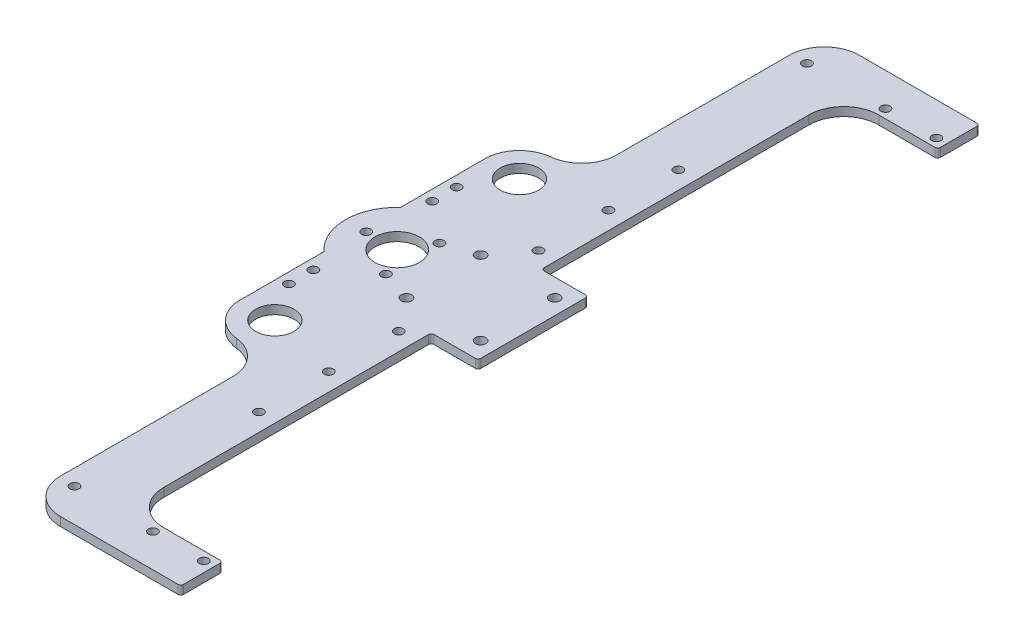
from build123d import *

# Parameters (mm, degrees)
SKETCH1_R           = 6.985
SKETCH1_R_2         = 1.6499967
SKETCH1_R_3         = 8.0645
BOSS_EXTRUDE1_DEPTH = 3.175
SKETCH4_R           = 1.65
CUT_EXTRUDE1_DEPTH  = 199.349545248
SKETCH5_R           = 1.89865
CUT_EXTRUDE2_DEPTH  = 199.349545248
FILLET1_R           = 1


with BuildPart() as part:
    # Sketch1 → Boss-Extrude1 (new body)
    with BuildSketch(Plane(origin=(0, 0, 0), x_dir=(1, 0, 0), z_dir=(0, 1, 0))):
        with BuildLine():
            ThreePointArc((-67.971311517, -24.866245744), (-74.128017531, -38.797272158), (-67.971311517, -52.728298572))
            Line((-67.971311517, -52.728298572), (-67.971311517, -82.586411585))
            ThreePointArc((-67.971311517, -82.586411585), (-64.941959488, -91.499608698), (-56.608448003, -95.878494725))
            ThreePointArc((-56.608448003, -95.878494725), (-48.492989851, -100.008926653), (-45.228378476, -108.509717293))
            Line((-45.228378476, -108.509717293), (-45.228378476, -171.249717293))
            ThreePointArc((-45.228378476, -171.249717293), (-41.508634597, -180.229973414), (-32.528378476, -183.949717293))
            Line((-32.528378476, -183.949717293), (7.398418219, -183.949717293))
            Line((7.398418219, -183.949717293), (11.211482469, -183.949717293))
            Line((11.211482469, -183.949717293), (11.211482469, -168.709717293))
            Line((11.211482469, -168.709717293), (-10.203517531, -168.709717293))
            ThreePointArc((-10.203517531, -168.709717293), (-19.183773652, -164.989973414), (-22.903517531, -156.009717293))
            Line((-22.903517531, -156.009717293), (-22.903517531, -58.797272158))
            Line((-22.903517531, -58.797272158), (-5.903517531, -58.797272158))
            Line((-5.903517531, -58.797272158), (-5.903517531, -38.797272158))
            Line((-5.903517531, -38.797272158), (-5.903517531, -18.797272158))
            Line((-5.903517531, -18.797272158), (-22.903517531, -18.797272158))
            Line((-22.903517531, -18.797272158), (-22.903517531, 78.415172977))
            ThreePointArc((-22.903517531, 78.415172977), (-19.183773652, 87.395429098), (-10.203517531, 91.115172977))
            Line((-10.203517531, 91.115172977), (11.211482469, 91.115172977))
            Line((11.211482469, 91.115172977), (11.211482469, 106.355172977))
            Line((11.211482469, 106.355172977), (-32.528378476, 106.355172977))
            ThreePointArc((-32.528378476, 106.355172977), (-41.508634597, 102.635429098), (-45.228378476, 93.655172977))
            Line((-45.228378476, 93.655172977), (-45.228378476, 30.915172977))
            ThreePointArc((-45.228378476, 30.915172977), (-48.492989851, 22.414382337), (-56.608448003, 18.28395041))
            ThreePointArc((-56.608448003, 18.28395041), (-64.941959488, 13.905064383), (-67.971311517, 4.991867269))
            Line((-67.971311517, 4.991867269), (-67.971311517, -24.866245744))
        make_face()
        with Locations((-55.288517531, -83.247272158)):
            Circle(SKETCH1_R, mode=Mode.SUBTRACT)
        with Locations((-64.161311517, -69.277272158)):
            Circle(SKETCH1_R_2, mode=Mode.SUBTRACT)
        with Locations((-64.161311517, -60.387272158)):
            Circle(SKETCH1_R_2, mode=Mode.SUBTRACT)
        with Locations((-49.668767531, -48.530964684)):
            Circle(SKETCH1_R_2, mode=Mode.SUBTRACT)
        with Locations((-29.342032123, -114.997272158)):
            Circle(SKETCH1_R_2, mode=Mode.SUBTRACT)
        with Locations((-29.342032123, -89.597272158)):
            Circle(SKETCH1_R_2, mode=Mode.SUBTRACT)
        with Locations((-29.342032123, -64.197272158)):
            Circle(SKETCH1_R_2, mode=Mode.SUBTRACT)
        with Locations((-66.528017531, -38.797272158)):
            Circle(SKETCH1_R_2, mode=Mode.SUBTRACT)
        with Locations((-64.161311517, -17.207272158)):
            Circle(SKETCH1_R_2, mode=Mode.SUBTRACT)
        with Locations((-64.161311517, -8.317272158)):
            Circle(SKETCH1_R_2, mode=Mode.SUBTRACT)
        with Locations((-55.288517531, -38.797272158)):
            Circle(SKETCH1_R_3, mode=Mode.SUBTRACT)
        with Locations((-55.288517531, 5.652727842)):
            Circle(SKETCH1_R, mode=Mode.SUBTRACT)
        with Locations((-49.668767531, -29.063579632)):
            Circle(SKETCH1_R_2, mode=Mode.SUBTRACT)
        with Locations((-29.342032123, -13.397272158)):
            Circle(SKETCH1_R_2, mode=Mode.SUBTRACT)
        with Locations((-29.342032123, 12.002727842)):
            Circle(SKETCH1_R_2, mode=Mode.SUBTRACT)
        with Locations((-29.342032123, 37.402727842)):
            Circle(SKETCH1_R_2, mode=Mode.SUBTRACT)
    extrude(amount=BOSS_EXTRUDE1_DEPTH)

    # Sketch4 → Cut-Extrude1 (cut, through all)
    with BuildSketch(Plane(origin=(0, 3.175, 0), x_dir=(1, 0, 0), z_dir=(0, 1, 0))):
        with Locations((7.528970241, 94.290172977)):
            Circle(SKETCH4_R)
        with Locations((-10.971029759, 94.290172977)):
            Circle(SKETCH4_R)
        with Locations((-39.471029759, 94.290172977)):
            Circle(SKETCH4_R)
        with Locations((-39.471029759, -171.884717293)):
            Circle(SKETCH4_R)
        with Locations((-10.971029759, -171.884717293)):
            Circle(SKETCH4_R)
        with Locations((7.528970241, -171.884717293)):
            Circle(SKETCH4_R)
    extrude(amount=-CUT_EXTRUDE1_DEPTH, mode=Mode.SUBTRACT)

    # Sketch5 → Cut-Extrude2 (cut, through all)
    with BuildSketch(Plane(origin=(0, 3.175, 0), x_dir=(1, 0, 0), z_dir=(0, 1, 0))):
        with Locations((-11.500645577, -25.326887976)):
            Circle(SKETCH5_R)
        with Locations((-38.441413941, -25.326887976)):
            Circle(SKETCH5_R)
        with Locations((-38.441413941, -52.267656339)):
            Circle(SKETCH5_R)
        with Locations((-11.500645577, -52.267656339)):
            Circle(SKETCH5_R)
    extrude(amount=-CUT_EXTRUDE2_DEPTH, mode=Mode.SUBTRACT)

    # Fillet1
    fillet1_edges = [part.edges().sort_by_distance(p)[0] for p in [
        (-22.903517531, 1.5875, 18.797272158),
        (-22.903517531, 1.5875, 58.797272158),
        (11.211482469, 1.5875, 183.949717293),
        (11.211482469, 1.5875, 168.709717293),
        (-5.903517531, 1.5875, 58.797272158),
        (-5.903517531, 1.5875, 18.797272158),
        (11.211482469, 1.5875, -106.355172977),
        (11.211482469, 1.5875, -91.115172977),
    ]]
    fillet(fillet1_edges, radius=FILLET1_R)


solid = part.part
